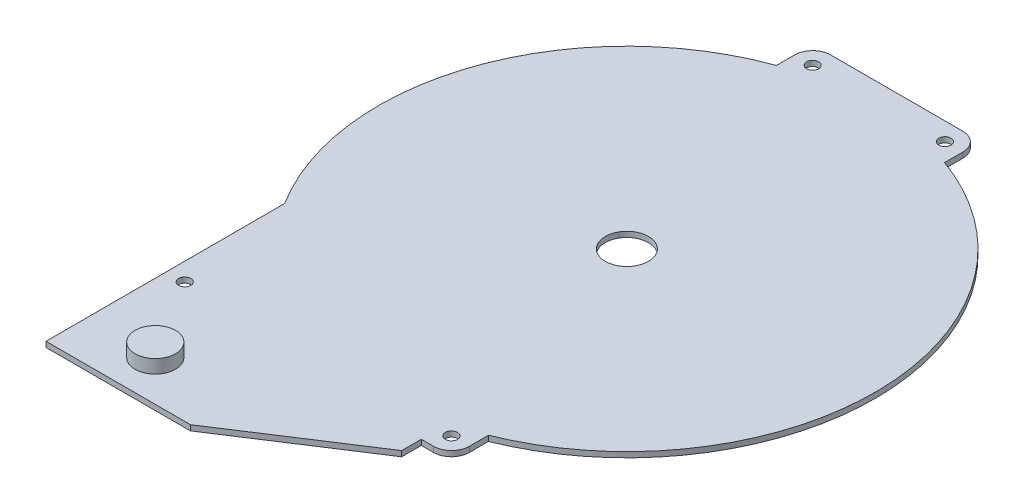
from build123d import *
from build123d.topology import SkipClean

# Parameters (mm, degrees)
SALIENTE_EXTRUIR1_DEPTH                   = 12.5
SALIENTE_EXTRUIR1_2_DEPTH                 = 12.5
CROQUIS4_R                                = 92
CROQUIS4_R_2                              = 17.5
SALIENTE_EXTRUIR3_DEPTH                   = 3
CROQUIS5_W                                = 42.3
CROQUIS5_H                                = 42.3
CROQUIS5_R                                = 19
CROQUIS5_R_2                              = 1.5
SALIENTE_EXTRUIR4_DEPTH                   = 10
CHAFL_N1_SIZE                             = 4
CROQUIS7_W                                = 46.3
CROQUIS7_H                                = 3
SALIENTE_EXTRUIR5_DEPTH                   = 70
SALIENTE_EXTRUIR7_START                   = -3.5
SALIENTE_EXTRUIR7_DEPTH                   = 7
CROQUIS15_W                               = 46.3
CROQUIS15_H                               = 2
SALIENTE_EXTRUIR8_DEPTH                   = 42.3
SALIENTE_EXTRUIR9_START                   = 21.15
SALIENTE_EXTRUIR9_DEPTH                   = 2
SALIENTE_EXTRUIR10_START                  = -15.5
SALIENTE_EXTRUIR10_DEPTH                  = 6
SALIENTE_EXTRUIR10_START_2                = -9.5
SALIENTE_EXTRUIR10_2_DEPTH                = 22
CROQUIS20_R                               = 2
SALIENTE_EXTRUIR11_DEPTH                  = 28
CORTAR_EXTRUIR2_DEPTH                     = 3.3
SALIENTE_EXTRUIR30_DEPTH                  = 3
SALIENTE_EXTRUIR27_REACH                  = 245.062
SALIENTE_EXTRUIR27_END_RADIUS             = 92
CROQUIS60_W                               = 3
CROQUIS60_H                               = 28
SALIENTE_EXTRUIR27_DIRECTION_2_REACH      = 245.062
SALIENTE_EXTRUIR28_START                  = 89.078617
CROQUIS61_W                               = 3
CROQUIS61_H                               = 28
SALIENTE_EXTRUIR28_DEPTH                  = 15.72116
SALIENTE_EXTRUIR32_DEPTH                  = 3
SALIENTE_EXTRUIR33_DEPTH                  = 3
SALIENTE_EXTRUIR34_DEPTH                  = 25
REDONDEO9_R                               = 5
REDONDEO10_R                              = 4
CORTAR_EXTRUIR6_OUTLINE_W                 = 2.65
CORTAR_EXTRUIR6_OUTLINE_H                 = 6.147817537
CROQUIS32_R                               = 3.65
CROQUIS32_R_2                             = 2.65
SALIENTE_EXTRUIR16_DEPTH                  = 5.5
SALIENTE_EXTRUIR16_DIRECTION_2_REACH      = 234.007
SALIENTE_EXTRUIR16_DIRECTION_2_END_RADIUS = 92
CORTAR_EXTRUIR21_OUTLINE_W                = 2.65
CORTAR_EXTRUIR21_OUTLINE_H                = 6.147460621
CROQUIS70_R                               = 3.65
CROQUIS70_R_2                             = 2.65
SALIENTE_EXTRUIR36_DEPTH                  = 5.5
SALIENTE_EXTRUIR36_DIRECTION_2_REACH      = 241.136
SALIENTE_EXTRUIR36_DIRECTION_2_END_RADIUS = 92
CROQUIS35_R                               = 3.5
CORTAR_EXTRUIR8_DEPTH                     = 3
CROQUIS37_R                               = 6
CROQUIS37_R_2                             = 2
SALIENTE_EXTRUIR18_DEPTH                  = 3
CORTAR_EXTRUIR10_DEPTH                    = 3
CORTAR_EXTRUIR10_DEPTH_BACK               = 3
CROQUIS41_R                               = 3.5
CROQUIS44_R                               = 5
CORTAR_EXTRUIR12_DEPTH                    = 3
CROQUIS42_R                               = 6
CROQUIS42_R_2                             = 2
SALIENTE_EXTRUIR20_DEPTH                  = 3.3
CORTAR_EXTRUIR14_REACH                    = 189.797
SALIENTE_EXTRUIR22_DEPTH                  = 3.3
SALIENTE_EXTRUIR23_DEPTH                  = 5
CORTAR_EXTRUIR15_DEPTH                    = 3.3
SIMETR_A11_START                          = -18.8
SIMETR_A11_DEPTH                          = 3.3
SIMETR_A11_START_2                        = -23.8
SIMETR_A11_2_DEPTH                        = 5
SIMETR_A11_START_3                        = -20.5
SIMETR_A11_3_DEPTH                        = 1.7
SALIENTE_EXTRUIR24_DEPTH                  = 3.3
CROQUIS53_R                               = 8
SALIENTE_EXTRUIR25_DEPTH                  = 5
CORTAR_EXTRUIR16_DEPTH                    = 3.3
CROQUIS55_R                               = 2
CORTAR_EXTRUIR18_DEPTH                    = 181.493683415
CORTAR_EXTRUIR19_REACH                    = 228.145
CORTAR_EXTRUIR19_END_RADIUS               = 89
CROQUIS56_W                               = 15
CROQUIS56_H                               = 10
CROQUIS69_R                               = 2
SALIENTE_EXTRUIR35_DEPTH                  = 28
SALIENTE_EXTRUIR37_DEPTH                  = 28
SALIENTE_EXTRUIR38_DEPTH                  = 2
SALIENTE_EXTRUIR39_START                  = -2
SALIENTE_EXTRUIR39_DEPTH                  = 2
SALIENTE_EXTRUIR40_DEPTH                  = 26
CROQUIS74_R                               = 2
CORTAR_EXTRUIR22_DEPTH                    = 170.285734049
CORTAR_EXTRUIR23_DEPTH                    = 3.3
CROQUIS79_R                               = 2.25
SALIENTE_EXTRUIR41_DEPTH                  = 2
CROQUIS81_R                               = 7.5
SALIENTE_EXTRUIR43_DEPTH                  = 5
CROQUIS82_R                               = 8
CORTAR_EXTRUIR24_DEPTH                    = 10


# Read off the part's stored shape, not the designer's step: Saliente-Extruir7, Saliente-Extruir9, Saliente-Extruir10, Cortar-Extruir6, Cortar-Extruir21, Simetría11
with BuildPart() as part:
    # Croquis1 → Saliente-Extruir1 (new, symmetric)
    with BuildSketch(Plane(origin=(0, 0, 0), x_dir=(1, 0, 0), z_dir=(0, 1, 0))):
        with BuildLine():
            Line((-17, 87.361318671), (-17, 90.4157066))
            ThreePointArc((-17, 90.4157066), (-90.786182549, 14.895269658), (-45, -80.243379789))
            Line((-45, -80.243379789), (-45, -76.785415282))
            ThreePointArc((-45, -76.785415282), (-87.732762221, 14.965374473), (-17, 87.361318671))
        make_face()
    extrude(amount=SALIENTE_EXTRUIR1_DEPTH, both=True)



with BuildPart() as body_2:
    # Croquis1 → Saliente-Extruir1 2 (new, symmetric)
    with BuildSketch(Plane(origin=(0, 0, 0), x_dir=(1, 0, 0), z_dir=(0, 1, 0))):
        with BuildLine():
            ThreePointArc((20, -89.799777283), (91.987255409, 1.531287769), (17, 90.4157066))
            Line((17, 90.4157066), (17, 87.361318671))
            ThreePointArc((17, 87.361318671), (88.986787561, 1.533505674), (20, -86.723699183))
            Line((20, -86.723699183), (20, -89.799777283))
        make_face()
    extrude(amount=SALIENTE_EXTRUIR1_2_DEPTH, both=True)


with BuildPart() as body_3:
    # Croquis4 → Saliente-Extruir3 (new body)
    with BuildSketch(Plane.XZ.offset(12.5)):
        with Locations(Location((0, 0, 0), (0, 0, 270))):
            Circle(CROQUIS4_R)
        with Locations(Location((0, 0, 0), (0, 0, 270))):
            Circle(CROQUIS4_R_2, mode=Mode.SUBTRACT)
    extrude(amount=SALIENTE_EXTRUIR3_DEPTH)


with BuildPart() as body_4:
    # Croquis5 → Saliente-Extruir4 (new body)
    with BuildSketch(Plane(origin=(0, -15.5, 0), x_dir=(-1, 0, 0), z_dir=(0, -1, 0))):
        Rectangle(CROQUIS5_W, CROQUIS5_H)
        with Locations(Location((0, 0, 0), (0, 0, 90))):
            Circle(CROQUIS5_R, mode=Mode.SUBTRACT)
        with Locations(Location((-15.5, -15.5, 0), (0, 0, 90))):
            Circle(CROQUIS5_R_2, mode=Mode.SUBTRACT)
        with Locations(Location((15.5, -15.5, 0), (0, 0, 270))):
            Circle(CROQUIS5_R_2, mode=Mode.SUBTRACT)
        with Locations(Location((-15.5, 15.5, 0), (0, 0, 270))):
            Circle(CROQUIS5_R_2, mode=Mode.SUBTRACT)
        with Locations(Location((15.5, 15.5, 0), (0, 0, 90))):
            Circle(CROQUIS5_R_2, mode=Mode.SUBTRACT)
    extrude(amount=SALIENTE_EXTRUIR4_DEPTH)

    # Chaflán1
    chafl_n1_edges = [body_4.edges().sort_by_distance(p)[0] for p in [
        (-21.15, -20.5, 21.15),
        (21.15, -20.5, 21.15),
        (21.15, -20.5, -21.15),
        (-21.15, -20.5, -21.15),
    ]]
    chamfer(chafl_n1_edges, length=CHAFL_N1_SIZE)


with BuildPart() as body_4_2:
    # Croquis7 → Saliente-Extruir5 (new body)
    with BuildSketch(Plane.XZ.offset(15.5)):
        with Locations((0, 22.65)):
            Rectangle(CROQUIS7_W, CROQUIS7_H)
    extrude(amount=SALIENTE_EXTRUIR5_DEPTH)


with BuildPart() as body_5:
    # Saliente-Extruir7 outline → Saliente-Extruir7 (new body)
    with BuildSketch(Plane.YZ.offset(SALIENTE_EXTRUIR7_START)):
        Polygon((-15.5, 73.164527675), (-85.5, 24.15), (-15.5, 24.15), align=None)
    extrude(amount=SALIENTE_EXTRUIR7_DEPTH)

    # Croquis44 → Cortar-Extruir12 (cut)
    with BuildSketch(Plane.XZ.offset(15.5)):
        with Locations((0, 73.164527675)):
            Circle(CROQUIS44_R)
    extrude(amount=CORTAR_EXTRUIR12_DEPTH, mode=Mode.SUBTRACT)

    # Croquis42 → Saliente-Extruir20 (add)
    with BuildSketch(Plane.XZ.offset(15.5)):
        with Locations((0, 73.164527675)):
            Circle(CROQUIS42_R)
        with Locations((0, 73.164527675)):
            Circle(CROQUIS42_R_2, mode=Mode.SUBTRACT)
    extrude(amount=SALIENTE_EXTRUIR20_DEPTH)

    # Cortar-Extruir14: up to this face of the body (flat: up to its plane)
    cortar_extruir14_end = Plane(body_5.part.faces().sort_by_distance((-3.5, -38.990764188, 40.274069561))[0])
    # Croquis45 → Cortar-Extruir14 (cut, up to the picked face)
    with BuildSketch(Plane(origin=(3.5, 0, 0), x_dir=(0, 0, -1), z_dir=(1, 0, 0)), mode=Mode.PRIVATE) as cortar_extruir14_sk1:
        Polygon((-70.853842799, -18.95), (-68.141130502, -18.95), (-68.141130502, -15.5), (-68.291130502, -15.5), (-68.291130502, -18.8), (-70.853842799, -18.8), align=None)
    cortar_extruir14_tool1 = split(extrude(cortar_extruir14_sk1.sketch, amount=-CORTAR_EXTRUIR14_REACH, mode=Mode.PRIVATE), bisect_by=cortar_extruir14_end, keep=Keep.BOTH, mode=Mode.PRIVATE)
    add(cortar_extruir14_tool1.solids().sort_by(Axis((3.5, -18.906112, 69.497487), (-1, 0, 0)))[0], mode=Mode.SUBTRACT)


with BuildPart() as body_6:
    # Croquis15 → Saliente-Extruir8 (new body)
    with BuildSketch(Plane(origin=(0, 0, 21.15), x_dir=(-1, 0, 0), z_dir=(0, 0, -1))):
        with Locations((0, -84.5)):
            Rectangle(CROQUIS15_W, CROQUIS15_H)
    extrude(amount=SALIENTE_EXTRUIR8_DEPTH)


with BuildPart() as body_7:
    # Saliente-Extruir9 outline → Saliente-Extruir9 (new body)
    with BuildSketch(Plane.YZ.offset(SALIENTE_EXTRUIR9_START)):
        Polygon((-53.5, 21.15), (-83.5, 21.15), (-83.5, -8.85), align=None)
    extrude(amount=SALIENTE_EXTRUIR9_DEPTH)


with BuildPart() as body_8:
    # Simetría10: mirrored copy
    add(body_7.part.mirror(Plane(origin=(0, 0, 0), x_dir=(0, 0, 1), z_dir=(1, 0, 0))))


with BuildPart() as part_1:
    add(part.part)

    add(body_2.part)  # Saliente-Extruir10 merges body 2

    add(body_3.part)  # Saliente-Extruir10 merges body 3
    # Saliente-Extruir10 outline → Saliente-Extruir10 (add)
    with BuildSketch(Plane(origin=(0, 0, 0), x_dir=(1, 0, 0), z_dir=(0, 1, 0)).offset(SALIENTE_EXTRUIR10_START)):
        with BuildLine():
            Line((-20, 100), (-20, 89.799777282))
            ThreePointArc((-20, 89.799777282), (-18.502563126, 90.12022613), (-17, 90.4157066))
            ThreePointArc((-17, 90.4157066), (0, 92), (17, 90.4157066))
            ThreePointArc((17, 90.4157066), (18.502563126, 90.12022613), (20, 89.799777283))
            Line((20, 89.799777283), (20, 100))
            Line((20, 100), (-20, 100))
        make_face()
    extrude(amount=SALIENTE_EXTRUIR10_DEPTH)

    # Saliente-Extruir10 2 outline → Saliente-Extruir10 2 (add)
    with SkipClean():  # the faces are left unmerged after this step: merging them gives an invalid solid
        with BuildSketch(Plane(origin=(0, 0, 0), x_dir=(1, 0, 0), z_dir=(0, 1, 0)).offset(SALIENTE_EXTRUIR10_START_2)):
            with BuildLine():
                ThreePointArc((-20, 89.799777282), (-18.502563126, 90.12022613), (-17, 90.4157066))
                Line((-17, 90.4157066), (-17, 100))
                Line((-17, 100), (-20, 100))
                Line((-20, 100), (-20, 89.799777282))
            make_face()
            with BuildLine():
                Line((17, 100), (17, 90.4157066))
                ThreePointArc((17, 90.4157066), (18.502563126, 90.12022613), (20, 89.799777283))
                Line((20, 89.799777283), (20, 100))
                Line((20, 100), (17, 100))
            make_face()
        extrude(amount=SALIENTE_EXTRUIR10_2_DEPTH)

    # Croquis20 → Saliente-Extruir11 (add)
    with SkipClean():  # the faces are left unmerged after this step: merging them gives an invalid solid
        with BuildSketch(Plane(origin=(0, 12.5, 0), x_dir=(1, 0, 0), z_dir=(0, 1, 0))):
            with BuildLine():
                Line((-20, 100), (-24.5, 100))
                ThreePointArc((-24.5, 100), (-29.210678119, 98.048773235), (-31.161904883, 93.338095117))
                Line((-31.161904883, 93.338095117), (-31.161904883, 86.561744923))
                ThreePointArc((-31.161904883, 86.561744923), (-25.632134933, 88.357193588), (-20, 89.799777283))
                Line((-20, 89.799777283), (-20, 100))
            make_face()
            with Locations(Location((-24.5, 93.338095117, 0), (0, 0, 270))):
                Circle(CROQUIS20_R, mode=Mode.SUBTRACT)
        saliente_extruir11 = extrude(amount=-SALIENTE_EXTRUIR11_DEPTH)

    # Simetría2: Saliente-Extruir11 across plane
    with SkipClean():  # the faces are left unmerged after this step: merging them gives an invalid solid
        add(saliente_extruir11.mirror(Plane(origin=(0, 0, 0), x_dir=(0, 0, 1), z_dir=(1, 0, 0))))

    # Croquis22 → Cortar-Extruir2 (cut)
    with SkipClean():  # the faces are left unmerged after this step: merging them gives an invalid solid
        with BuildSketch(Plane.XZ.offset(15.5)):
            Polygon((22.479274058, -89.838095117), (26.520725942, -89.838095117), (28.541451884, -93.338095117), (26.520725942, -96.838095117), (22.479274058, -96.838095117), (20.458548116, -93.338095117), align=None)
            Polygon((-26.520725942, -89.838095117), (-28.541451884, -93.338095117), (-26.520725942, -96.838095117), (-22.479274058, -96.838095117), (-20.458548116, -93.338095117), (-22.479274058, -89.838095117), align=None)
        extrude(amount=-CORTAR_EXTRUIR2_DEPTH, mode=Mode.SUBTRACT)

    # Croquis65 → Saliente-Extruir30 (add)
    with BuildSketch(Plane(origin=(0, -12.5, 0), x_dir=(1, 0, 0), z_dir=(0, 1, 0))):
        with BuildLine():
            Line((-45, -80.243379789), (-73.381594056, -104.799777283))
            Line((-73.381594056, -104.799777283), (20, -104.799777283))
            Line((20, -104.799777283), (20, -89.799777283))
            ThreePointArc((20, -89.799777283), (-13.382121777, -91.021529413), (-45, -80.243379789))
        make_face()
    extrude(amount=-SALIENTE_EXTRUIR30_DEPTH)

    # Saliente-Extruir27: up to this cylinder (the profile starts outside it)
    saliente_extruir27_end = Plane(origin=(0, -1.5, 0), z_dir=(0, -1, 0)) * Cylinder(SALIENTE_EXTRUIR27_END_RADIUS, 675.124, mode=Mode.PRIVATE)
    # Croquis60 → Saliente-Extruir27 (add, up to the surface)
    with BuildSketch(Plane(origin=(-69.573094964, 0, 60.196216302), x_dir=(-0.6543066989345575, 0, -0.7562292930912968), z_dir=(0.7562292930912968, 0, -0.6543066989345575)), mode=Mode.PRIVATE) as saliente_extruir27_sk1:
        with Locations((-29.738592921, -1.5)):
            Rectangle(CROQUIS60_W, CROQUIS60_H)
    saliente_extruir27_tool1 = extrude(saliente_extruir27_sk1.sketch, amount=SALIENTE_EXTRUIR27_REACH, mode=Mode.PRIVATE) - saliente_extruir27_end
    add(saliente_extruir27_tool1.solids().sort_by_distance((-50.114934, -1.5, 82.685411))[0])

    # Saliente-Extruir27 direction 2: up to this plane
    saliente_extruir27_direction_2_end = Plane(origin=(-73.381594056, -112.056401995, 104.799777283), z_dir=(0, 0, 1))
    # Croquis60 → Saliente-Extruir27 direction 2 (add, up to the surface)
    with BuildSketch(Plane(origin=(-69.573094964, 0, 60.196216302), x_dir=(-0.6543066989345575, 0, -0.7562292930912968), z_dir=(0.7562292930912968, 0, -0.6543066989345575)), mode=Mode.PRIVATE) as saliente_extruir27_direction_2_sk1:
        with Locations((-29.738592921, -1.5)):
            Rectangle(CROQUIS60_W, CROQUIS60_H)
    saliente_extruir27_direction_2_tool1 = split(extrude(saliente_extruir27_direction_2_sk1.sketch, amount=-SALIENTE_EXTRUIR27_DIRECTION_2_REACH, mode=Mode.PRIVATE), bisect_by=saliente_extruir27_direction_2_end, keep=Keep.BOTH, mode=Mode.PRIVATE)
    add(saliente_extruir27_direction_2_tool1.solids().sort_by_distance((-50.114934, -1.5, 82.685411))[0])

    # Croquis61 → Saliente-Extruir28 (add)
    with BuildSketch(Plane.XY.offset(SALIENTE_EXTRUIR28_START)):
        with Locations((21.5, -1.5)):
            Rectangle(CROQUIS61_W, CROQUIS61_H)
    extrude(amount=SALIENTE_EXTRUIR28_DEPTH)

    # Croquis66 → Saliente-Extruir32 (add)
    with BuildSketch(Plane(origin=(0, -12.5, 0), x_dir=(1, 0, 0), z_dir=(0, 1, 0))):
        Polygon((-74.966599841, -104.799777283), (-74.966599841, -119.799777283), (-3.097974457, -119.799777283), (20, -104.799777283), align=None)
    extrude(amount=-SALIENTE_EXTRUIR32_DEPTH)

    # Croquis67 → Saliente-Extruir33 (add)
    with BuildSketch(Plane(origin=(0, -12.5, 0), x_dir=(1, 0, 0), z_dir=(0, 1, 0))):
        Polygon((20, -104.799777283), (23, -104.799777283), (23, -106.428644381), (-24.458364465, -137.248466626), (-29.966599841, -137.248466626), (-77.966599841, -137.248466626), (-77.966599841, -104.799777283), (-74.966599841, -104.799777283), (-74.966599841, -119.799777283), (-3.097974457, -119.799777283), align=None)
    extrude(amount=-SALIENTE_EXTRUIR33_DEPTH)

    # Croquis68 → Saliente-Extruir34 (add)
    with BuildSketch(Plane(origin=(0, -12.5, 0), x_dir=(1, 0, 0), z_dir=(0, 1, 0))):
        Polygon((-74.966599841, -106.171160159), (-74.966599841, -137.248466626), (-77.966599841, -137.248466626), (-77.966599841, -104.799777283), (-73.381594056, -104.799777283), align=None)
        Polygon((20, -104.799777283), (-29.966599841, -137.248466626), (-24.458364465, -137.248466626), (23, -106.428644381), (23, -104.799777283), align=None)
    extrude(amount=SALIENTE_EXTRUIR34_DEPTH)

    # Redondeo9
    # the kernel refuses this fillet: 5 mm, written as the material it takes off along each edge
    with BuildSketch(Plane(origin=(-45, -12.5, 80.243379789), x_dir=(0, 0, -1), z_dir=(0, 1, 0))) as redondeo9_piece_1:
        with BuildLine():
            CenterArc((REDONDEO9_R * 0.457127625475, REDONDEO9_R), REDONDEO9_R, 220.867101081, 49.132898919)
            Line((-REDONDEO9_R * 0.299101667616, REDONDEO9_R * 0.345693301065), (0, 0))
            Line((0, 0), (REDONDEO9_R * 0.457127625475, 0))
        make_face()
    extrude(amount=30.714095318, mode=Mode.SUBTRACT)
    with BuildSketch(Plane(origin=(-45, 19.533949217, 76.785415282), x_dir=(-0.8548787678181875, 0, -0.518827806052892), z_dir=(0, -1, 0))) as redondeo9_piece_2:
        with BuildLine():
            CenterArc((2.814630463, -4.999408566), REDONDEO9_R, 90.88127216, 57.865071996)
            Line((-1.459763376, -2.405269536), (0, 0))
            ThreePointArc((0, 0), (1.368863996, -0.010527525), (2.737727991, 0))
        make_face()
    extrude(amount=32.033949217, mode=Mode.SUBTRACT)

    # Redondeo10
    redondeo10_edges = [part_1.edges().sort_by_distance(p)[0] for p in [
        (20, 0, 86.723699183),
    ]]
    fillet(redondeo10_edges, radius=REDONDEO10_R)

    # Cortar-Extruir6 outline → Cortar-Extruir6 (revolve, cut)
    with BuildSketch(Plane(origin=(7.255228308, 0, 41.146444401), x_dir=(0, 1, 0), z_dir=(-0.17364817766693907, 0, -0.9848077530122066))):
        with Locations((1.325, 80.189494924)):
            Rectangle(CORTAR_EXTRUIR6_OUTLINE_W, CORTAR_EXTRUIR6_OUTLINE_H)
    revolve(axis=Axis((7.255228308, 0, 41.146444401), (0.9848077530122066, 0, -0.17364817766693907)), mode=Mode.SUBTRACT)

    # Croquis32 → Saliente-Extruir16 (add)
    with BuildSketch(Plane(origin=(87.975419613, -12.5, 26.913296786), x_dir=(-0.17364817766693919, 0, -0.9848077530122067), z_dir=(0.9848077530122067, 0, -0.17364817766693919))):
        with Locations((0, 12.5)):
            Circle(CROQUIS32_R)
        with Locations((0, 12.5)):
            Circle(CROQUIS32_R_2, mode=Mode.SUBTRACT)
    extrude(amount=SALIENTE_EXTRUIR16_DEPTH)

    # Saliente-Extruir16 direction 2: up to this cylinder (the profile starts outside it)
    saliente_extruir16_direction_2_end = Plane(origin=(0, 0, 0), z_dir=(0, -1, 0)) * Cylinder(SALIENTE_EXTRUIR16_DIRECTION_2_END_RADIUS, 653.014, mode=Mode.PRIVATE)
    # Croquis32 → Saliente-Extruir16 direction 2 (add, up to the surface)
    with BuildSketch(Plane(origin=(87.975419613, -12.5, 26.913296786), x_dir=(-0.17364817766693919, 0, -0.9848077530122067), z_dir=(0.9848077530122067, 0, -0.17364817766693919)), mode=Mode.PRIVATE) as saliente_extruir16_direction_2_sk1:
        with Locations((0, 12.5)):
            Circle(CROQUIS32_R)
        with Locations((0, 12.5)):
            Circle(CROQUIS32_R_2, mode=Mode.SUBTRACT)
    saliente_extruir16_direction_2_tool1 = extrude(saliente_extruir16_direction_2_sk1.sketch, amount=-SALIENTE_EXTRUIR16_DIRECTION_2_REACH, mode=Mode.PRIVATE) - saliente_extruir16_direction_2_end
    add(saliente_extruir16_direction_2_tool1.solids().sort_by_distance((88.591308, 0, 30.406176))[0])

    # Cortar-Extruir21 outline → Cortar-Extruir21 (revolve, cut)
    with BuildSketch(Plane(origin=(39.261480281, 0, -14.290010176), x_dir=(0.9396926207859093, 0, -0.3420201433256662), z_dir=(0, -1, 0))):
        with Locations((1.325, 80.189673382)):
            Rectangle(CORTAR_EXTRUIR21_OUTLINE_W, CORTAR_EXTRUIR21_OUTLINE_H)
    revolve(axis=Axis((39.261480281, 0, -14.290010176), (0.3420201433256662, 0, 0.9396926207859093)), mode=Mode.SUBTRACT)

    # Croquis70 → Saliente-Extruir36 (add)
    with BuildSketch(Plane(origin=(67.295308523, -12.5, 62.7322999), x_dir=(0.9396926207859095, 0, -0.3420201433256657), z_dir=(0.3420201433256657, 0, 0.9396926207859095))):
        with Locations((0, 12.5)):
            Circle(CROQUIS70_R)
        with Locations((0, 12.5)):
            Circle(CROQUIS70_R_2, mode=Mode.SUBTRACT)
    extrude(amount=SALIENTE_EXTRUIR36_DEPTH)

    # Saliente-Extruir36 direction 2: up to this cylinder (the profile starts outside it)
    with SkipClean():  # the faces are left unmerged after this step: merging them gives an invalid solid
        saliente_extruir36_direction_2_end = Plane(origin=(0, 0, 0), z_dir=(0, -1, 0)) * Cylinder(SALIENTE_EXTRUIR36_DIRECTION_2_END_RADIUS, 667.272, mode=Mode.PRIVATE)
        # Croquis70 → Saliente-Extruir36 direction 2 (add, up to the surface)
        with BuildSketch(Plane(origin=(67.295308523, -12.5, 62.7322999), x_dir=(0.9396926207859095, 0, -0.3420201433256657), z_dir=(0.3420201433256657, 0, 0.9396926207859095)), mode=Mode.PRIVATE) as saliente_extruir36_direction_2_sk1:
            with Locations((0, 12.5)):
                Circle(CROQUIS70_R)
            with Locations((0, 12.5)):
                Circle(CROQUIS70_R_2, mode=Mode.SUBTRACT)
        saliente_extruir36_direction_2_tool1 = extrude(saliente_extruir36_direction_2_sk1.sketch, amount=-SALIENTE_EXTRUIR36_DIRECTION_2_REACH, mode=Mode.PRIVATE) - saliente_extruir36_direction_2_end
        add(saliente_extruir36_direction_2_tool1.solids().sort_by_distance((63.962442, 0, 63.945364))[0])

    # Croquis35 → Cortar-Extruir8 (cut)
    with BuildSketch(Plane.XZ.offset(15.5)):
        with Locations((-13.15, 30.15)):
            Circle(CROQUIS35_R)
    cortar_extruir8 = extrude(amount=-CORTAR_EXTRUIR8_DEPTH, mode=Mode.SUBTRACT)

    # Simetría3: Cortar-Extruir8 across plane
    add(cortar_extruir8.mirror(Plane(origin=(0, 0, 0), x_dir=(0, 0, 1), z_dir=(1, 0, 0))), mode=Mode.SUBTRACT)

    # Croquis41 → Cortar-Extruir10 (cut, two sides: drawn at the far end of the back side and taken through both)
    with BuildSketch(Plane.XZ.offset(15.5).offset(-CORTAR_EXTRUIR10_DEPTH_BACK)):
        with Locations(Location((0, 73.164527675, 0), (0, 0, 180))):
            Circle(CROQUIS41_R)
    extrude(amount=CORTAR_EXTRUIR10_DEPTH + CORTAR_EXTRUIR10_DEPTH_BACK, mode=Mode.SUBTRACT)

    # Cortar-Extruir19: up to this cylinder (the profile starts outside it)
    cortar_extruir19_end = Plane(origin=(0, 0, 0), z_dir=(0, -1, 0)) * Cylinder(CORTAR_EXTRUIR19_END_RADIUS, 635.29, mode=Mode.PRIVATE)
    # Croquis56 → Cortar-Extruir19 (cut, up to the surface)
    with BuildSketch(Plane(origin=(79.674337148, 0, 46), x_dir=(-0.4999999999999977, 0, 0.8660254037844399), z_dir=(-0.8660254037844399, 0, -0.4999999999999977)), mode=Mode.PRIVATE) as cortar_extruir19_sk1:
        Rectangle(CROQUIS56_W, CROQUIS56_H)
    cortar_extruir19_tool1 = extrude(cortar_extruir19_sk1.sketch, amount=CORTAR_EXTRUIR19_REACH, mode=Mode.PRIVATE) - cortar_extruir19_end
    add(cortar_extruir19_tool1.solids().sort_by_distance((79.674337, 0, 46))[0], mode=Mode.SUBTRACT)

    # Croquis69 → Saliente-Extruir35 (add)
    with BuildSketch(Plane(origin=(0, 12.5, 0), x_dir=(1, 0, 0), z_dir=(0, 1, 0))):
        with BuildLine():
            Line((23, -99.148648639), (23, -89.078616963))
            Line((23, -89.078616963), (34.15, -85.427030266))
            Line((34.15, -85.427030266), (34.15, -92.498648639))
            ThreePointArc((34.15, -92.498648639), (32.202260095, -97.200908734), (27.5, -99.148648639))
            Line((27.5, -99.148648639), (23, -99.148648639))
        make_face()
        with Locations(Location((27.5, -92.498648639, 0), (0, 0, 270))):
            Circle(CROQUIS69_R, mode=Mode.SUBTRACT)
    extrude(amount=-SALIENTE_EXTRUIR35_DEPTH)

    # Croquis71 → Saliente-Extruir37 (add)
    with BuildSketch(Plane(origin=(0, 12.5, 0), x_dir=(1, 0, 0), z_dir=(0, 1, 0))):
        with BuildLine():
            Line((-74.966599841, -102.204109388), (-77.966599841, -104.799777283))
            Line((-77.966599841, -104.799777283), (-77.966599841, -48.838604701))
            ThreePointArc((-77.966599841, -48.838604701), (-76.499557941, -51.105945201), (-74.966599841, -53.329250025))
            Line((-74.966599841, -53.329250025), (-74.966599841, -102.204109388))
        make_face()
    extrude(amount=-SALIENTE_EXTRUIR37_DEPTH)

    # Croquis72 → Saliente-Extruir38 (add)
    with BuildSketch(Plane(origin=(0, 12.5, 0), x_dir=(1, 0, 0), z_dir=(0, 1, 0))):
        with BuildLine():
            Line((-47.737994791, -78.645304077), (-74.966599841, -102.204109388))
            Line((-74.966599841, -102.204109388), (-74.966599841, -53.329250025))
            ThreePointArc((-74.966599841, -53.329250025), (-62.644473293, -67.377072998), (-47.737994791, -78.645304077))
        make_face()
    extrude(amount=-SALIENTE_EXTRUIR38_DEPTH)

    # Croquis73 → Saliente-Extruir39 (add)
    with BuildSketch(Plane.XZ.offset(15.5).offset(SALIENTE_EXTRUIR39_START)):
        with BuildLine():
            Line((-74.966599841, 102.204109388), (-74.966599841, 53.329250025))
            ThreePointArc((-74.966599841, 53.329250025), (-62.644473293, 67.377072998), (-47.737994791, 78.645304077))
            Line((-47.737994791, 78.645304077), (-74.966599841, 102.204109388))
        make_face()
    extrude(amount=SALIENTE_EXTRUIR39_DEPTH)

    # Croquis76 → Saliente-Extruir40 (add)
    with BuildSketch(Plane(origin=(0, 12.5, 0), x_dir=(1, 0, 0), z_dir=(0, 1, 0))):
        with BuildLine():
            Line((-71.316599841, -85.848648639), (-74.966599841, -85.848648639))
            Line((-74.966599841, -85.848648639), (-74.966599841, -102.204109388))
            Line((-74.966599841, -102.204109388), (-64.666599841, -93.292316285))
            Line((-64.666599841, -93.292316285), (-64.666599841, -92.498648639))
            ThreePointArc((-64.666599841, -92.498648639), (-66.614339746, -87.796388544), (-71.316599841, -85.848648639))
        make_face()
    extrude(amount=-SALIENTE_EXTRUIR40_DEPTH)

    # Croquis74 → Cortar-Extruir22 (cut, through all)
    with BuildSketch(Plane(origin=(0, 12.5, 0), x_dir=(1, 0, 0), z_dir=(0, 1, 0))):
        with Locations(Location((-71.316599841, -92.498648639, 0), (0, 0, 270))):
            Circle(CROQUIS74_R)
    extrude(amount=-CORTAR_EXTRUIR22_DEPTH, mode=Mode.SUBTRACT)

    # Croquis77 → Cortar-Extruir23 (cut)
    with BuildSketch(Plane.XZ.offset(15.5)):
        Polygon((25.479274058, 88.998648639), (29.520725942, 88.998648639), (31.541451884, 92.498648639), (29.520725942, 95.998648639), (25.479274058, 95.998648639), (23.458548116, 92.498648639), align=None)
        Polygon((-69.295873899, 88.998648639), (-67.275147957, 92.498648639), (-69.295873899, 95.998648639), (-73.337325783, 95.998648639), (-75.358051726, 92.498648639), (-73.337325783, 88.998648639), align=None)
    extrude(amount=-CORTAR_EXTRUIR23_DEPTH, mode=Mode.SUBTRACT)


with BuildPart() as body_7_2:
    # Croquis37 → Saliente-Extruir18 (new body)
    with BuildSketch(Plane.XZ.offset(15.5)):
        with Locations((-13.15, 30.15)):
            Circle(CROQUIS37_R)
        with Locations((-13.15, 30.15)):
            Circle(CROQUIS37_R_2, mode=Mode.SUBTRACT)
    extrude(amount=SALIENTE_EXTRUIR18_DEPTH)


with BuildPart() as body_8_2:
    # Simetría5: mirrored copy
    add(body_7_2.part.mirror(Plane(origin=(0, 0, 0), x_dir=(0, 0, 1), z_dir=(1, 0, 0))))


with BuildPart() as cortar_extruir14_piece_1:
    # of the separate pieces the step leaves, piece 1, a body of its own (cortar_extruir14_pieces)
    add(body_5.part.solids().sort_by_distance((3.5, -15.5, 68.141130502))[0])


with BuildPart() as cortar_extruir14_piece_2:
    # of the separate pieces the step leaves, piece 2, a body of its own (cortar_extruir14_pieces)
    add(body_5.part.solids().sort_by_distance((-3.5, -15.5, 68.291130502))[0])


with BuildPart() as body_10:
    # Croquis46 → Saliente-Extruir22 (new body)
    with BuildSketch(Plane.XZ.offset(15.5)):
        with BuildLine():
            Line((6.95, 30.15), (6.95, 24.15))
            Line((6.95, 24.15), (5.15, 24.15))
            Line((5.15, 24.15), (5.15, 30.15))
            ThreePointArc((5.15, 30.15), (13.15, 38.15), (21.15, 30.15))
            Line((21.15, 30.15), (21.15, 24.15))
            Line((21.15, 24.15), (19.35, 24.15))
            Line((19.35, 24.15), (19.35, 30.15))
            ThreePointArc((19.35, 30.15), (13.15, 36.35), (6.95, 30.15))
        make_face()
    extrude(amount=SALIENTE_EXTRUIR22_DEPTH)


with BuildPart() as body_11:
    # Croquis48 → Saliente-Extruir23 (new body)
    with BuildSketch(Plane.XZ.offset(18.8)):
        with BuildLine():
            Line((5.15, 30.15), (5.15, 24.15))
            Line((5.15, 24.15), (21.15, 24.15))
            Line((21.15, 24.15), (21.15, 30.15))
            ThreePointArc((21.15, 30.15), (13.15, 38.15), (5.15, 30.15))
        make_face()
    extrude(amount=SALIENTE_EXTRUIR23_DEPTH)

    # Croquis50 → Cortar-Extruir15 (cut)
    with BuildSketch(Plane.XZ.offset(23.8)):
        Polygon((15.170725942, 26.65), (17.191451884, 30.15), (15.170725942, 33.65), (11.129274058, 33.65), (9.108548116, 30.15), (11.129274058, 26.65), align=None)
    extrude(amount=-CORTAR_EXTRUIR15_DEPTH, mode=Mode.SUBTRACT)


with BuildPart() as body_12:
    # Simetría11 outline → Simetría11 (new body)
    with BuildSketch(Plane(origin=(0, 0, 0), x_dir=(1, 0, 0), z_dir=(0, 1, 0)).offset(SIMETR_A11_START)):
        with BuildLine():
            ThreePointArc((-6.95, -30.15), (-13.15, -36.35), (-19.35, -30.15))
            Line((-19.35, -30.15), (-19.35, -24.15))
            Line((-19.35, -24.15), (-21.15, -24.15))
            Line((-21.15, -24.15), (-21.15, -30.15))
            ThreePointArc((-21.15, -30.15), (-13.15, -38.15), (-5.15, -30.15))
            Line((-5.15, -30.15), (-5.15, -24.15))
            Line((-5.15, -24.15), (-6.95, -24.15))
            Line((-6.95, -24.15), (-6.95, -30.15))
        make_face()
    extrude(amount=SIMETR_A11_DEPTH)


with BuildPart() as body_13:
    # Simetr_a11 2 outline → Simetr_a11 2 (new body)
    with BuildSketch(Plane(origin=(0, 0, 0), x_dir=(1, 0, 0), z_dir=(0, 1, 0)).offset(SIMETR_A11_START_2)):
        with BuildLine():
            Line((-21.15, -24.15), (-21.15, -30.15))
            ThreePointArc((-21.15, -30.15), (-13.15, -38.15), (-5.15, -30.15))
            Line((-5.15, -30.15), (-5.15, -24.15))
            Line((-5.15, -24.15), (-21.15, -24.15))
        make_face()
        Polygon((-15.170725942, -26.65), (-11.129274058, -26.65), (-9.108548116, -30.15), (-11.129274058, -33.65), (-15.170725942, -33.65), (-17.191451884, -30.15), align=None, mode=Mode.SUBTRACT)
    extrude(amount=SIMETR_A11_2_DEPTH)

    # Simetr_a11 3 outline → Simetr_a11 3 (add)
    with BuildSketch(Plane(origin=(0, 0, 0), x_dir=(1, 0, 0), z_dir=(0, 1, 0)).offset(SIMETR_A11_START_3)):
        Polygon((-9.108548116, -30.15), (-11.129274058, -26.65), (-15.170725942, -26.65), (-17.191451884, -30.15), (-15.170725942, -33.65), (-11.129274058, -33.65), align=None)
    extrude(amount=SIMETR_A11_3_DEPTH)


with BuildPart() as body_14:
    # Croquis51 → Saliente-Extruir24 (new body)
    with BuildSketch(Plane.XZ.offset(15.5)):
        with BuildLine():
            Line((3.5, 68.107601731), (3.5, 65.97078039))
            ThreePointArc((3.5, 65.97078039), (0, 81.164527675), (-3.5, 65.97078039))
            Line((-3.5, 65.97078039), (-3.5, 68.107601731))
            ThreePointArc((-3.5, 68.107601731), (0, 79.314527675), (3.5, 68.107601731))
        make_face()
    extrude(amount=SALIENTE_EXTRUIR24_DEPTH)


with BuildPart() as body_15:
    # Croquis53 → Saliente-Extruir25 (new body)
    with BuildSketch(Plane.XZ.offset(18.8)):
        with Locations((0, 73.164527675)):
            Circle(CROQUIS53_R)
    extrude(amount=SALIENTE_EXTRUIR25_DEPTH)

    # Croquis54 → Cortar-Extruir16 (cut)
    with BuildSketch(Plane.XZ.offset(23.8)):
        Polygon((2.020725942, 69.664527675), (4.041451884, 73.164527675), (2.020725942, 76.664527675), (-2.020725942, 76.664527675), (-4.041451884, 73.164527675), (-2.020725942, 69.664527675), align=None)
    extrude(amount=-CORTAR_EXTRUIR16_DEPTH, mode=Mode.SUBTRACT)


with BuildPart() as cortar_extruir18_tool:
    # Croquis55 → Cortar-Extruir18 (new, through all)
    with BuildSketch(Plane.XZ.offset(15.5)):
        with Locations(Location((13.15, 30.15, 0), (0, 0, 180))):
            Circle(CROQUIS55_R)
        with Locations((0, 73.164527675)):
            Circle(CROQUIS55_R)
        with Locations((-13.15, 30.15)):
            Circle(CROQUIS55_R)
    extrude(amount=CORTAR_EXTRUIR18_DEPTH)


with BuildPart() as body_11_1:
    add(body_11.part)

    # Cortar-Extruir18: cut by cortar_extruir18_tool
    add(cortar_extruir18_tool.part, mode=Mode.SUBTRACT)


with BuildPart() as body_13_1:
    add(body_13.part)

    # Cortar-Extruir18: cut by cortar_extruir18_tool
    add(cortar_extruir18_tool.part, mode=Mode.SUBTRACT)


with BuildPart() as body_15_1:
    add(body_15.part)

    # Cortar-Extruir18: cut by cortar_extruir18_tool
    add(cortar_extruir18_tool.part, mode=Mode.SUBTRACT)


with BuildPart() as body_5_2:
    # Croquis79 → Saliente-Extruir41 (new body)
    with BuildSketch(Plane.XZ.offset(15.5)):
        with BuildLine():
            Line((34.15, 85.427030266), (34.15, 92.498648639))
            ThreePointArc((34.15, 92.498648639), (32.202260095, 97.200908734), (27.5, 99.148648639))
            Line((27.5, 99.148648639), (23, 99.148648639))
            Line((23, 99.148648639), (23, 106.428644381))
            Line((23, 106.428644381), (-24.458364465, 137.248466626))
            Line((-24.458364465, 137.248466626), (-77.966599841, 137.248466626))
            Line((-77.966599841, 137.248466626), (-77.966599841, 48.838604701))
            ThreePointArc((-77.966599841, 48.838604701), (-86.951545733, -30.057090587), (-31.161904883, -86.561744923))
            Line((-31.161904883, -86.561744923), (-31.161904883, -93.338095117))
            ThreePointArc((-31.161904883, -93.338095117), (-29.210678119, -98.048773235), (-24.5, -100))
            Line((-24.5, -100), (24.5, -100))
            ThreePointArc((24.5, -100), (29.210678119, -98.048773235), (31.161904883, -93.338095117))
            Line((31.161904883, -93.338095117), (31.161904883, -86.561744923))
            ThreePointArc((31.161904883, -86.561744923), (91.986118124, -1.598146565), (34.15, 85.427030266))
        make_face()
        with Locations((24.5, -93.338095117)):
            Circle(CROQUIS79_R, mode=Mode.SUBTRACT)
        with Locations((-24.5, -93.338095117)):
            Circle(CROQUIS79_R, mode=Mode.SUBTRACT)
        with Locations((27.5, 92.498648639)):
            Circle(CROQUIS79_R, mode=Mode.SUBTRACT)
        with Locations((-71.316599841, 92.498648639)):
            Circle(CROQUIS79_R, mode=Mode.SUBTRACT)
    extrude(amount=-SALIENTE_EXTRUIR41_DEPTH)

    # Croquis81 → Saliente-Extruir43 (add)
    with BuildSketch(Plane(origin=(0, -13.5, 0), x_dir=(1, 0, 0), z_dir=(0, 1, 0))):
        with Locations((-52.466599841, -122.248466626)):
            Circle(CROQUIS81_R)
    extrude(amount=SALIENTE_EXTRUIR43_DEPTH)

    # Croquis82 → Cortar-Extruir24 (cut)
    with BuildSketch(Plane(origin=(0, -13.5, 0), x_dir=(1, 0, 0), z_dir=(0, 1, 0))):
        with Locations(Location((0, 0, 0), (0, 0, 180))):
            Circle(CROQUIS82_R)
    extrude(amount=-CORTAR_EXTRUIR24_DEPTH, mode=Mode.SUBTRACT)


solid = body_5_2.part
